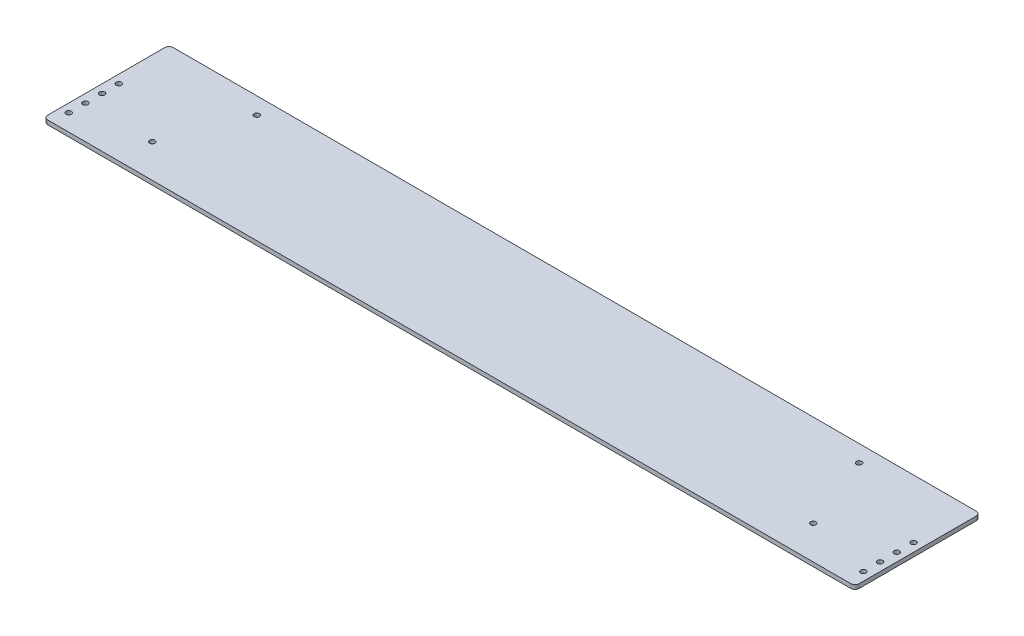
from build123d import *

# Parameters (mm, degrees)
SKETCH1_W           = 615.95
SKETCH1_H           = 95.25
SKETCH1_R           = 2.0193
BOSS_EXTRUDE1_DEPTH = 3.175
FILLET1_R           = 3.175
SKETCH2_R           = 2.0193
CUT_EXTRUDE1_DEPTH  = 312.651763793


with BuildPart() as part:
    # Sketch1 → Boss-Extrude1 (new body)
    with BuildSketch(Plane(origin=(0, 0, 0), x_dir=(1, 0, 0), z_dir=(0, 1, 0))):
        Rectangle(SKETCH1_W, SKETCH1_H)
        with Locations((-301.625, 3.175)):
            Circle(SKETCH1_R, mode=Mode.SUBTRACT)
        with Locations((-301.625, -9.525)):
            Circle(SKETCH1_R, mode=Mode.SUBTRACT)
        with Locations((-301.625, -22.225)):
            Circle(SKETCH1_R, mode=Mode.SUBTRACT)
        with Locations((-301.625, -34.925)):
            Circle(SKETCH1_R, mode=Mode.SUBTRACT)
        with Locations((301.625, -34.925)):
            Circle(SKETCH1_R, mode=Mode.SUBTRACT)
        with Locations((301.625, -22.225)):
            Circle(SKETCH1_R, mode=Mode.SUBTRACT)
        with Locations((301.625, -9.525)):
            Circle(SKETCH1_R, mode=Mode.SUBTRACT)
        with Locations((301.625, 3.175)):
            Circle(SKETCH1_R, mode=Mode.SUBTRACT)
    extrude(amount=BOSS_EXTRUDE1_DEPTH)

    # Fillet1
    fillet1_edges = [part.edges().sort_by_distance(p)[0] for p in [
        (307.975, 1.5875, 47.625),
        (-307.975, 1.5875, -47.625),
        (307.975, 1.5875, -47.625),
        (-307.975, 1.5875, 47.625),
    ]]
    fillet(fillet1_edges, radius=FILLET1_R)

    # Sketch2 → Cut-Extrude1 (cut, through all)
    with BuildSketch(Plane(origin=(0, 3.175, 0), x_dir=(1, 0, 0), z_dir=(0, 1, 0))):
        with Locations((-228.6, 34.925)):
            Circle(SKETCH2_R)
        with Locations((-250.825, -22.225)):
            Circle(SKETCH2_R)
        with Locations((250.825, -22.225)):
            Circle(SKETCH2_R)
        with Locations((228.6, 34.925)):
            Circle(SKETCH2_R)
    extrude(amount=-CUT_EXTRUDE1_DEPTH, mode=Mode.SUBTRACT)


solid = part.part
